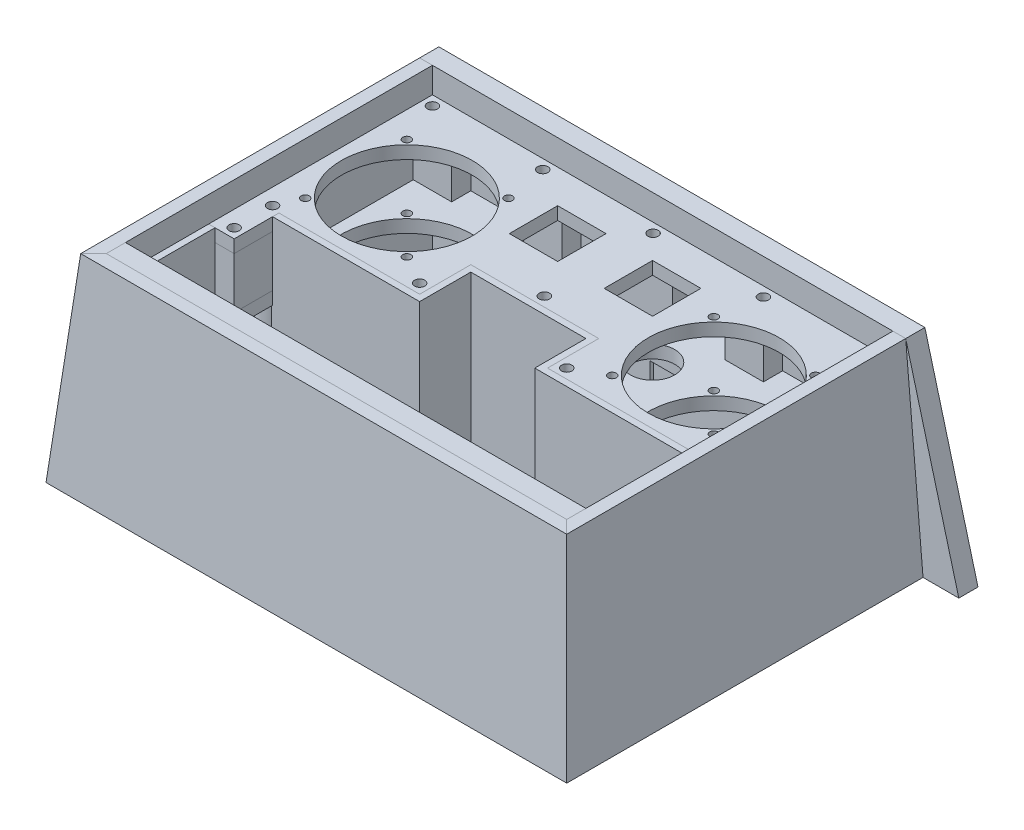
from build123d import *

# Parameters (mm, degrees)
SKETCH3_W               = 114.3
SKETCH3_H               = 88.9
SKETCH3_R               = 32.5
BOSS_EXTRUDE1_DEPTH     = 6.35
SKETCH12_W              = 12.7
SKETCH12_H              = 22.225
BOSS_EXTRUDE8_DEPTH     = 6.35
SKETCH5_R               = 10.9728
CUT_EXTRUDE1_DEPTH      = 141.992881026
SKETCH47_W              = 24
SKETCH47_H              = 24
CUT_EXTRUDE19_DEPTH     = 6.35
SKETCH22_R              = 2.0193
CUT_EXTRUDE7_DEPTH      = 143.557146436
SKETCH51_R              = 2.5527
CUT_EXTRUDE20_DEPTH     = 143.557146436
CUT_EXTRUDE5_DEPTH      = 143.557146436
CUT_EXTRUDE5_DEPTH_BACK = 143.557146436
SKETCH18_R              = 2.5527
CUT_EXTRUDE6_DEPTH      = 143.557146436
CUT_EXTRUDE6_DEPTH_BACK = 143.557146436
SKETCH19_R              = 2.5527
SKETCH19_W              = 63.5
SKETCH19_H              = 25.4
BOSS_EXTRUDE9_REACH     = 142.993
SKETCH48_W              = 19.05
SKETCH48_H              = 9.525
SKETCH48_R              = 2.5527
SKETCH48_W_2            = 28.575
BOSS_EXTRUDE11_REACH    = 142.993
SKETCH52_W              = 9.525
SKETCH52_H              = 28.575
SKETCH52_R              = 2.5527
BOSS_EXTRUDE12_DEPTH    = 3.175
SKETCH54_W              = 3.175
SKETCH54_H              = 19.05
CUT_EXTRUDE21_DEPTH     = 143.557146436
SKETCH56_W              = 60.325
SKETCH56_H              = 38.1
SKETCH56_R              = 1.5875
SKETCH56_R_2            = 9.525
BOSS_EXTRUDE14_DEPTH    = 3.175
SKETCH55_W              = 228.6
SKETCH55_H              = 76.2
BOSS_EXTRUDE13_DEPTH    = 9.525
BOSS_EXTRUDE15_DEPTH    = 9.525
CUT_EXTRUDE23_DEPTH     = 249.97517152
BOSS_EXTRUDE16_DEPTH    = 3.175
SKETCH61_W              = 111.125
SKETCH61_H              = 9.525
BOSS_EXTRUDE17_DEPTH    = 22.225
SKETCH62_R              = 4.7625
BOSS_EXTRUDE18_DEPTH    = 47.625
BOSS_EXTRUDE19_DEPTH    = 38.1
BOSS_EXTRUDE20_DEPTH    = 6.35
SKETCH65_R              = 25.4
CUT_EXTRUDE22_DEPTH     = 300.006928584
SKETCH67_R              = 4.7625
BOSS_EXTRUDE21_DEPTH    = 6.35
LPATTERN1_COUNT         = 2
LPATTERN1_PITCH         = 76.2
LPATTERN2_COUNT         = 2
LPATTERN2_PITCH         = 76.2
SKETCH68_W              = 12.7
SKETCH68_H              = 12.7
CUT_EXTRUDE24_DEPTH     = 260.504568724
BOSS_EXTRUDE23_START    = -171.45
SKETCH69_R              = 4.7625
BOSS_EXTRUDE23_DEPTH    = 177.8


with BuildPart() as part:
    # Sketch3 → Boss-Extrude1 (new body)
    with BuildSketch(Plane(origin=(0, 53.975, 0), x_dir=(1, 0, 0), z_dir=(0, 1, 0))):
        with Locations((-57.15, 31.75)):
            Rectangle(SKETCH3_W, SKETCH3_H)
        with Locations(Location((-76.2, 25.4, 0), (0, 0, 270))):
            Circle(SKETCH3_R, mode=Mode.SUBTRACT)
    extrude(amount=BOSS_EXTRUDE1_DEPTH)

    # Sketch12 → Boss-Extrude8 (add)
    with BuildSketch(Plane(origin=(0, 60.325, 0), x_dir=(1, 0, 0), z_dir=(0, 1, 0))):
        with Locations((-107.95, -23.8125)):
            Rectangle(SKETCH12_W, SKETCH12_H)
    extrude(amount=-BOSS_EXTRUDE8_DEPTH)


with BuildPart() as body_2:
    # Mirror1: mirrored copy
    add(part.part.mirror(Plane.ZX.offset(73.025)))

    # Mirror2 2: body 2 across plane


with BuildPart() as part_1:
    add(part.part)

    # Mirror2: part across plane
    add(part.part.mirror(Plane(origin=(0, 0, 0), x_dir=(0, 0, 1), z_dir=(1, 0, 0))))

    # Sketch5 → Cut-Extrude1 (cut, through all)
    with BuildSketch(Plane(origin=(0, 60.325, 0), x_dir=(1, 0, 0), z_dir=(0, 1, 0))):
        with Locations(Location((-23.548581453, 47.625, 0), (0, 0, 270))):
            Circle(SKETCH5_R)
    cut_extrude1 = extrude(amount=-CUT_EXTRUDE1_DEPTH, mode=Mode.SUBTRACT)


with BuildPart() as body_2_1:
    add(body_2.part)
    add(body_2.part.mirror(Plane(origin=(0, 0, 0), x_dir=(0, 0, 1), z_dir=(1, 0, 0))))

    # Sketch47 → Cut-Extrude19 (cut)
    with BuildSketch(Plane(origin=(0, 92.075, 0), x_dir=(1, 0, 0), z_dir=(0, 1, 0))):
        with Locations((-23.548581453, 47.625)):
            Rectangle(SKETCH47_W, SKETCH47_H)
    cut_extrude19 = extrude(amount=-CUT_EXTRUDE19_DEPTH, mode=Mode.SUBTRACT)


with BuildPart() as cut_extrude7_tool:
    # Sketch22 → Cut-Extrude7 (new, through all)
    with BuildSketch(Plane(origin=(0, 92.075, 0), x_dir=(1, 0, 0), z_dir=(0, 1, 0))):
        with Locations(Location((-101.426034419, 50.626034419, 0), (0, 0, 270))):
            Circle(SKETCH22_R)
        with Locations(Location((-50.973965581, 50.626034419, 0), (0, 0, 270))):
            Circle(SKETCH22_R)
        with Locations(Location((-50.973965581, 0.173965581, 0), (0, 0, 270))):
            Circle(SKETCH22_R)
        with Locations(Location((-101.426034419, 0.173965581, 0), (0, 0, 270))):
            Circle(SKETCH22_R)
    cut_extrude7 = extrude(amount=-CUT_EXTRUDE7_DEPTH)


with BuildPart() as part_2:
    add(part_1.part)

    # Cut-Extrude7: cut by cut_extrude7_tool
    add(cut_extrude7_tool.part, mode=Mode.SUBTRACT)


with BuildPart() as body_2_2:
    add(body_2_1.part)

    # Cut-Extrude7: cut by cut_extrude7_tool
    add(cut_extrude7_tool.part, mode=Mode.SUBTRACT)


with BuildPart() as cut_extrude20_tool:
    # Sketch51 → Cut-Extrude20 (new, through all)
    with BuildSketch(Plane(origin=(0, 92.075, 0), x_dir=(1, 0, 0), z_dir=(0, 1, 0))):
        with Locations(Location((-106.3625, -30.1625, 0), (0, 0, 270))):
            Circle(SKETCH51_R)
        with Locations(Location((-106.3625, -11.1125, 0), (0, 0, 270))):
            Circle(SKETCH51_R)
    cut_extrude20 = extrude(amount=-CUT_EXTRUDE20_DEPTH)


with BuildPart() as part_3:
    add(part_2.part)

    # Cut-Extrude20: cut by cut_extrude20_tool
    add(cut_extrude20_tool.part, mode=Mode.SUBTRACT)


with BuildPart() as body_2_3:
    add(body_2_2.part)

    # Cut-Extrude20: cut by cut_extrude20_tool
    add(cut_extrude20_tool.part, mode=Mode.SUBTRACT)


with BuildPart() as mirror8_tool:
    # Mirror8: Cut-Extrude1, Cut-Extrude19, Cut-Extrude7, Cut-Extrude20 across plane
    add(cut_extrude1.mirror(Plane(origin=(0, 0, 0), x_dir=(0, 0, 1), z_dir=(1, 0, 0))))
    add(cut_extrude19.mirror(Plane(origin=(0, 0, 0), x_dir=(0, 0, 1), z_dir=(1, 0, 0))))
    add(cut_extrude7.mirror(Plane(origin=(0, 0, 0), x_dir=(0, 0, 1), z_dir=(1, 0, 0))))
    add(cut_extrude20.mirror(Plane(origin=(0, 0, 0), x_dir=(0, 0, 1), z_dir=(1, 0, 0))))


with BuildPart() as part_4:
    add(part_3.part)

    # Mirror8: cut by mirror8_tool
    add(mirror8_tool.part, mode=Mode.SUBTRACT)


with BuildPart() as body_2_4:
    add(body_2_3.part)

    # Mirror8: cut by mirror8_tool
    add(mirror8_tool.part, mode=Mode.SUBTRACT)


with BuildPart() as cut_extrude5_tool:
    # Sketch18 → Cut-Extrude5 (new, two sides: drawn at the far end of the back side and taken through both)
    with BuildSketch(Plane(origin=(0, 92.075, 0), x_dir=(1, 0, 0), z_dir=(0, 1, 0)).offset(-CUT_EXTRUDE5_DEPTH_BACK)):
        with Locations(Location((-54.76875, 71.4375, 0), (0, 0, 90))):
            Circle(SKETCH18_R)
        with Locations(Location((-109.5375, 71.4375, 0), (0, 0, 90))):
            Circle(SKETCH18_R)
        with Locations(Location((0, 71.4375, 0), (0, 0, 90))):
            Circle(SKETCH18_R)
        with Locations(Location((109.5375, 71.4375, 0), (0, 0, 90))):
            Circle(SKETCH18_R)
        with Locations(Location((54.76875, 71.4375, 0), (0, 0, 90))):
            Circle(SKETCH18_R)
    extrude(amount=CUT_EXTRUDE5_DEPTH + CUT_EXTRUDE5_DEPTH_BACK)


with BuildPart() as part_5:
    add(part_4.part)

    # Cut-Extrude5: cut by cut_extrude5_tool
    add(cut_extrude5_tool.part, mode=Mode.SUBTRACT)


with BuildPart() as body_2_5:
    add(body_2_4.part)

    # Cut-Extrude5: cut by cut_extrude5_tool
    add(cut_extrude5_tool.part, mode=Mode.SUBTRACT)


with BuildPart() as cut_extrude6_tool:
    # Sketch19 → Cut-Extrude6 (new, two sides: drawn at the far end of the back side and taken through both)
    with BuildSketch(Plane(origin=(0, 92.075, 0), x_dir=(1, 0, 0), z_dir=(0, 1, 0)).offset(-CUT_EXTRUDE6_DEPTH_BACK)):
        with Locations(Location((-36.5125, -7.9375, 0), (0, 0, 90))):
            Circle(SKETCH19_R)
        with Locations(Location((36.5125, -7.9375, 0), (0, 0, 90))):
            Circle(SKETCH19_R)
        with Locations(Location((0, 17.4625, 0), (0, 0, 90))):
            Circle(SKETCH19_R)
        Rectangle(SKETCH19_W, SKETCH19_H)
    extrude(amount=CUT_EXTRUDE6_DEPTH + CUT_EXTRUDE6_DEPTH_BACK)


with BuildPart() as part_6:
    add(part_5.part)

    # Cut-Extrude6: cut by cut_extrude6_tool
    add(cut_extrude6_tool.part, mode=Mode.SUBTRACT)

    # Sketch54 → Cut-Extrude21 (cut, through all)
    with BuildSketch(Plane.XZ.offset(-53.975)):
        with Locations((-112.7125, 25.4)):
            Rectangle(SKETCH54_W, SKETCH54_H)
        with Locations((112.7125, 25.4)):
            Rectangle(SKETCH54_W, SKETCH54_H)
    extrude(amount=-CUT_EXTRUDE21_DEPTH, mode=Mode.SUBTRACT)


with BuildPart() as body_2_6:
    add(body_2_5.part)

    # Cut-Extrude6: cut by cut_extrude6_tool
    add(cut_extrude6_tool.part, mode=Mode.SUBTRACT)


with BuildPart() as body_3:

    # Sketch48 → Boss-Extrude9 (new, up to next)
    with BuildSketch(Plane(origin=(0, 60.325, 0), x_dir=(1, 0, 0), z_dir=(0, 1, 0)), mode=Mode.PRIVATE) as boss_extrude9_sk1:
        with Locations((-104.775, 71.4375)):
            Rectangle(SKETCH48_W, SKETCH48_H)
        with Locations(Location((-109.5375, 71.4375, 0), (0, 0, 90))):
            Circle(SKETCH48_R, mode=Mode.SUBTRACT)
    boss_extrude9_tool1 = extrude(boss_extrude9_sk1.sketch, amount=BOSS_EXTRUDE9_REACH, mode=Mode.PRIVATE) - body_2_6.part
    # Sketch48 → Boss-Extrude9 (new, up to next)
    with BuildSketch(Plane(origin=(0, 60.325, 0), x_dir=(1, 0, 0), z_dir=(0, 1, 0)), mode=Mode.PRIVATE) as boss_extrude9_sk2:
        with Locations((-50.00625, 71.4375)):
            Rectangle(SKETCH48_W, SKETCH48_H)
        with Locations(Location((-54.76875, 71.4375, 0), (0, 0, 90))):
            Circle(SKETCH48_R, mode=Mode.SUBTRACT)
    boss_extrude9_tool2 = extrude(boss_extrude9_sk2.sketch, amount=BOSS_EXTRUDE9_REACH, mode=Mode.PRIVATE) - body_2_6.part
    # Sketch48 → Boss-Extrude9 (new, up to next)
    with BuildSketch(Plane(origin=(0, 60.325, 0), x_dir=(1, 0, 0), z_dir=(0, 1, 0)), mode=Mode.PRIVATE) as boss_extrude9_sk3:
        with Locations((0, 71.4375)):
            Rectangle(SKETCH48_W_2, SKETCH48_H)
        with Locations(Location((0, 71.4375, 0), (0, 0, 90))):
            Circle(SKETCH48_R, mode=Mode.SUBTRACT)
    boss_extrude9_tool3 = extrude(boss_extrude9_sk3.sketch, amount=BOSS_EXTRUDE9_REACH, mode=Mode.PRIVATE) - body_2_6.part
    # Sketch48 → Boss-Extrude9 (new, up to next)
    with BuildSketch(Plane(origin=(0, 60.325, 0), x_dir=(1, 0, 0), z_dir=(0, 1, 0)), mode=Mode.PRIVATE) as boss_extrude9_sk4:
        with Locations((50.00625, 71.4375)):
            Rectangle(SKETCH48_W, SKETCH48_H)
        with Locations(Location((54.76875, 71.4375, 0), (0, 0, 90))):
            Circle(SKETCH48_R, mode=Mode.SUBTRACT)
    boss_extrude9_tool4 = extrude(boss_extrude9_sk4.sketch, amount=BOSS_EXTRUDE9_REACH, mode=Mode.PRIVATE) - body_2_6.part
    # Sketch48 → Boss-Extrude9 (new, up to next)
    with BuildSketch(Plane(origin=(0, 60.325, 0), x_dir=(1, 0, 0), z_dir=(0, 1, 0)), mode=Mode.PRIVATE) as boss_extrude9_sk5:
        with Locations((104.775, 71.4375)):
            Rectangle(SKETCH48_W, SKETCH48_H)
        with Locations(Location((109.5375, 71.4375, 0), (0, 0, 90))):
            Circle(SKETCH48_R, mode=Mode.SUBTRACT)
    boss_extrude9_tool5 = extrude(boss_extrude9_sk5.sketch, amount=BOSS_EXTRUDE9_REACH, mode=Mode.PRIVATE) - body_2_6.part
    add(boss_extrude9_tool1.solids().sort_by_distance((-104.169362, 60.325, -71.4375))[0])
    add(boss_extrude9_tool2.solids().sort_by_distance((-49.400612, 60.325, -71.4375))[0])
    add(boss_extrude9_tool3.solids().sort_by_distance((0, 60.325, -75.898793))[0])
    add(boss_extrude9_tool4.solids().sort_by_distance((49.400612, 60.325, -71.4375))[0])
    add(boss_extrude9_tool5.solids().sort_by_distance((104.169362, 60.325, -71.4375))[0])


with BuildPart() as body_4:

    # Sketch52 → Boss-Extrude11 (new, up to next)
    with BuildSketch(Plane(origin=(0, 60.325, 0), x_dir=(1, 0, 0), z_dir=(0, 1, 0)), mode=Mode.PRIVATE) as boss_extrude11_sk1:
        with Locations((-106.3625, -20.6375)):
            Rectangle(SKETCH52_W, SKETCH52_H)
        with Locations(Location((-106.3625, -30.1625, 0), (0, 0, 90))):
            Circle(SKETCH52_R, mode=Mode.SUBTRACT)
        with Locations(Location((-106.3625, -11.1125, 0), (0, 0, 90))):
            Circle(SKETCH52_R, mode=Mode.SUBTRACT)
    boss_extrude11_tool1 = extrude(boss_extrude11_sk1.sketch, amount=BOSS_EXTRUDE11_REACH, mode=Mode.PRIVATE) - body_2_6.part
    add(boss_extrude11_tool1.solids().sort_by_distance((-106.3625, 60.325, 20.6375))[0])


with BuildPart() as body_5:
    # Sketch53 → Boss-Extrude12 (new body)
    with BuildSketch(Plane.ZY.offset(111.125)):
        Polygon((34.925, 92.075), (34.925, 85.725), (6.35, 85.725), (6.35, 60.325), (15.875, 60.325), (15.875, 53.975), (15.875, 47.625), (76.2, 47.625), (76.2, 92.075), align=None)
    extrude(amount=BOSS_EXTRUDE12_DEPTH)

    # Sketch56 → Boss-Extrude14 (add)
    with BuildSketch(Plane.ZY.offset(114.3)):
        with Locations((46.0375, 28.575)):
            Rectangle(SKETCH56_W, SKETCH56_H)
        with Locations((26.035, 43.815)):
            Circle(SKETCH56_R, mode=Mode.SUBTRACT)
        with Locations((56.515, 43.815)):
            Circle(SKETCH56_R, mode=Mode.SUBTRACT)
        with Locations((56.515, 13.335)):
            Circle(SKETCH56_R, mode=Mode.SUBTRACT)
        with Locations((26.035, 13.335)):
            Circle(SKETCH56_R, mode=Mode.SUBTRACT)
        with Locations((41.275, 28.575)):
            Circle(SKETCH56_R_2, mode=Mode.SUBTRACT)
    extrude(amount=-BOSS_EXTRUDE14_DEPTH)


with BuildPart() as body_6:
    # Mirror9: mirrored copy
    add(body_5.part.mirror(Plane(origin=(0, 0, 0), x_dir=(0, 0, 1), z_dir=(1, 0, 0))))


with BuildPart() as body_7:
    # Mirror9 2: mirrored copy
    add(body_4.part.mirror(Plane(origin=(0, 0, 0), x_dir=(0, 0, 1), z_dir=(1, 0, 0))))


with BuildPart() as body_8:
    # Sketch55 → Boss-Extrude13 (new body)
    with BuildSketch(Plane.XY.offset(76.2)):
        with Locations((0, 66.675)):
            Rectangle(SKETCH55_W, SKETCH55_H)
    extrude(amount=BOSS_EXTRUDE13_DEPTH)

    # Sketch66 → Cut-Extrude23 (cut, through all)
    with BuildSketch(Plane.XY.offset(85.725)):
        Polygon((5.499261314, 57.15), (10.998522628, 66.675), (5.499261314, 76.2), (-5.499261314, 76.2), (-10.998522628, 66.675), (-5.499261314, 57.15), align=None)
        Polygon((19.247414599, 61.9125), (13.748153285, 52.3875), (19.247414599, 42.8625), (30.245937227, 42.8625), (35.745198541, 52.3875), (30.245937227, 61.9125), align=None)
        Polygon((30.245937227, 71.4375), (35.745198541, 80.9625), (30.245937227, 90.4875), (19.247414599, 90.4875), (13.748153285, 80.9625), (19.247414599, 71.4375), align=None)
        Polygon((68.740766425, 61.9125), (63.241505111, 52.3875), (68.740766425, 42.8625), (79.739289053, 42.8625), (85.238550367, 52.3875), (79.739289053, 61.9125), align=None)
        Polygon((79.739289053, 71.4375), (85.238550367, 80.9625), (79.739289053, 90.4875), (68.740766425, 90.4875), (63.241505111, 80.9625), (68.740766425, 71.4375), align=None)
        Polygon((54.99261314, 57.15), (60.491874454, 66.675), (54.99261314, 76.2), (43.994090512, 76.2), (38.494829198, 66.675), (43.994090512, 57.15), align=None)
        Polygon((-79.739289053, 61.9125), (-68.740766425, 61.9125), (-63.241505111, 52.3875), (-68.740766425, 42.8625), (-79.739289053, 42.8625), (-85.238550367, 52.3875), align=None)
        Polygon((-68.740766425, 71.4375), (-79.739289053, 71.4375), (-85.238550367, 80.9625), (-79.739289053, 90.4875), (-68.740766425, 90.4875), (-63.241505111, 80.9625), align=None)
        Polygon((-43.994090512, 57.15), (-54.99261314, 57.15), (-60.491874454, 66.675), (-54.99261314, 76.2), (-43.994090512, 76.2), (-38.494829198, 66.675), align=None)
        Polygon((-19.247414599, 71.4375), (-30.245937227, 71.4375), (-35.745198541, 80.9625), (-30.245937227, 90.4875), (-19.247414599, 90.4875), (-13.748153285, 80.9625), align=None)
        Polygon((-30.245937227, 61.9125), (-19.247414599, 61.9125), (-13.748153285, 52.3875), (-19.247414599, 42.8625), (-30.245937227, 42.8625), (-35.745198541, 52.3875), align=None)
    extrude(amount=-CUT_EXTRUDE23_DEPTH, mode=Mode.SUBTRACT)


with BuildPart() as body_9:
    # Sketch57 → Boss-Extrude15 (new body)
    with BuildSketch(Plane(origin=(0, 0, -76.2), x_dir=(-1, 0, 0), z_dir=(0, 0, -1))):
        Polygon((-120.65, 104.775), (120.65, 104.775), (147.022899265, 6.35), (-147.022899265, 6.35), align=None)
    extrude(amount=BOSS_EXTRUDE15_DEPTH)

    # Sketch68 → Cut-Extrude24 (cut, through all)
    with BuildSketch(Plane.XY.offset(-85.725)):
        with Locations((76.2, 25.4)):
            Rectangle(SKETCH68_W, SKETCH68_H)
        with Locations((0, 25.4)):
            Rectangle(SKETCH68_W, SKETCH68_H)
        with Locations((-76.2, 25.4)):
            Rectangle(SKETCH68_W, SKETCH68_H)
    extrude(amount=CUT_EXTRUDE24_DEPTH, mode=Mode.SUBTRACT)


with BuildPart() as body_10:
    # Sweep1: sweep along a path in Sketch59
    with BuildLine(Plane(origin=(0, 104.775, 0), x_dir=(1, 0, 0), z_dir=(0, 1, 0))) as sweep1_path:
        Line((-114.3, 76.2), (-114.3, -85.725))
        Line((-114.3, -85.725), (114.3, -85.725))
        Line((114.3, -85.725), (114.3, 76.2))
    # Sketch58 → Sweep1 (sweep)
    with BuildSketch(Plane.XY.offset(-76.2)):
        Polygon((-129.261071708, 6.35), (-120.65, 104.775), (-114.3, 104.775), (-114.3, 6.35), align=None)
    sweep(path=sweep1_path.line, transition=Transition.RIGHT)


with BuildPart() as body_11:
    # Sketch60 → Boss-Extrude16 (new body)
    with BuildSketch(Plane(origin=(-114.3, 0, 0), x_dir=(0, 0, -1), z_dir=(1, 0, 0))):
        Polygon((-85.725, 28.575), (-76.2, 28.575), (-76.2, 9.525), (-15.875, 9.525), (-15.875, 53.975), (-9.525, 53.975), (-9.525, 6.35), (-85.725, 6.35), align=None)
    extrude(amount=BOSS_EXTRUDE16_DEPTH)


with BuildPart() as body_12:
    # Sketch61 → Boss-Extrude17 (new body)
    with BuildSketch(Plane.XZ.offset(-28.575)):
        with Locations((-55.5625, 80.9625)):
            Rectangle(SKETCH61_W, SKETCH61_H)
    extrude(amount=BOSS_EXTRUDE17_DEPTH)


with BuildPart() as body_13:
    # Sketch62 → Boss-Extrude18 (new body)
    with BuildSketch(Plane.XZ.offset(-53.975)):
        with BuildLine():
            Line((-106.3625, 4.7625), (-114.3, 4.7625))
            Line((-114.3, 4.7625), (-114.3, 15.875))
            Line((-114.3, 15.875), (-110.562630206, 15.875))
            ThreePointArc((-110.562630206, 15.875), (-106.3625, 17.4625), (-102.162369794, 15.875))
            Line((-102.162369794, 15.875), (-28.575, 15.875))
            Line((-28.575, 15.875), (-28.575, -9.525))
            Line((-28.575, -9.525), (0, -9.525))
            Line((0, -9.525), (0, -12.7))
            Line((0, -12.7), (-31.75, -12.7))
            Line((-31.75, -12.7), (-31.75, 12.7))
            Line((-31.75, 12.7), (-100.214138938, 12.7))
            ThreePointArc((-100.214138938, 12.7), (-101.342384214, 7.223935033), (-106.3625, 4.7625))
        make_face()
        with Locations(Location((-106.3625, 11.1125, 0), (0, 0, 90))):
            Circle(SKETCH62_R, mode=Mode.SUBTRACT)
    extrude(amount=BOSS_EXTRUDE18_DEPTH)


with BuildPart() as body_14:
    # Sketch63 → Boss-Extrude19 (new body)
    with BuildSketch(Plane(origin=(0, 53.975, 0), x_dir=(1, 0, 0), z_dir=(0, 1, 0))):
        Polygon((-101.6, -12.7), (-101.6, -15.875), (-28.575, -15.875), (-28.575, 9.525), (0, 9.525), (0, 12.7), (-31.75, 12.7), (-31.75, -12.7), align=None)
    extrude(amount=BOSS_EXTRUDE19_DEPTH)


with BuildPart() as body_15:
    # Mirror14: mirrored copy
    add(body_14.part.mirror(Plane(origin=(0, 0, 0), x_dir=(0, 0, 1), z_dir=(1, 0, 0))))


with BuildPart() as body_16:
    # Mirror14 2: mirrored copy
    add(body_13.part.mirror(Plane(origin=(0, 0, 0), x_dir=(0, 0, 1), z_dir=(1, 0, 0))))


with BuildPart() as body_17:
    # Mirror14 3: mirrored copy
    add(body_12.part.mirror(Plane(origin=(0, 0, 0), x_dir=(0, 0, 1), z_dir=(1, 0, 0))))


with BuildPart() as body_18:
    # Mirror14 4: mirrored copy
    add(body_11.part.mirror(Plane(origin=(0, 0, 0), x_dir=(0, 0, 1), z_dir=(1, 0, 0))))


with BuildPart() as body_10_1:
    add(body_10.part)

    # Combine1: union body 17, body 12, body 16, body 13, body 18, body 11, body 14, body 15
    add(body_17.part)
    add(body_12.part)
    add(body_16.part)
    add(body_13.part)
    add(body_18.part)
    add(body_11.part)
    add(body_14.part)
    add(body_15.part)

    # Sketch64 → Boss-Extrude20 (add)
    with BuildSketch(Plane.XZ.offset(-6.35)):
        with BuildLine():
            Line((111.125, 76.2), (-111.125, 76.2))
            Line((-111.125, 76.2), (-111.125, 15.875))
            Line((-111.125, 15.875), (-110.562630206, 15.875))
            ThreePointArc((-110.562630206, 15.875), (-106.3625, 17.4625), (-102.162369794, 15.875))
            Line((-102.162369794, 15.875), (-28.575, 15.875))
            Line((-28.575, 15.875), (-28.575, -9.525))
            Line((-28.575, -9.525), (28.575, -9.525))
            Line((28.575, -9.525), (28.575, 15.875))
            Line((28.575, 15.875), (102.162369794, 15.875))
            ThreePointArc((102.162369794, 15.875), (106.3625, 17.4625), (110.562630206, 15.875))
            Line((110.562630206, 15.875), (111.125, 15.875))
            Line((111.125, 15.875), (111.125, 76.2))
        make_face()
    extrude(amount=-BOSS_EXTRUDE20_DEPTH)

    # Sketch65 → Cut-Extrude22 (cut, through all)
    with BuildSketch(Plane(origin=(-114.3, 0, 0), x_dir=(0, 0, -1), z_dir=(1, 0, 0))):
        with Locations((-41.275, 28.575)):
            Circle(SKETCH65_R)
    extrude(amount=-CUT_EXTRUDE22_DEPTH, mode=Mode.SUBTRACT)


with BuildPart() as body_11_2:
    # Sketch67 → Boss-Extrude21 (new, symmetric)
    with BuildSketch(Plane(origin=(0, 0, 0), x_dir=(0, 0, -1), z_dir=(1, 0, 0))):
        with BuildLine():
            Line((85.725, 6.35), (85.725, 19.05))
            Line((85.725, 19.05), (78.105, 19.05))
            Line((78.105, 19.05), (78.105, 31.75))
            Line((78.105, 31.75), (85.725, 31.75))
            Line((85.725, 31.75), (85.725, 44.45))
            Line((85.725, 44.45), (92.075, 44.45))
            Line((92.075, 44.45), (112.395, 29.21))
            ThreePointArc((112.395, 29.21), (116.823277885, 15.033907372), (104.775, 6.35))
            Line((104.775, 6.35), (85.725, 6.35))
        make_face()
        with Locations((104.775, 19.05)):
            Circle(SKETCH67_R, mode=Mode.SUBTRACT)
    extrude(amount=BOSS_EXTRUDE21_DEPTH, both=True)


with BuildPart() as lpattern1_1:
    # LPattern1: pattern copy
    add(body_11_2.part.moved(Location(Vector(-1, 0, 0) * (1 * LPATTERN1_PITCH))))


with BuildPart() as lpattern2_1:
    # LPattern2: pattern copy
    add(body_11_2.part.moved(Location(Vector(1, 0, 0) * (1 * LPATTERN2_PITCH))))


with BuildPart() as body_14_2:
    # Sketch69 → Boss-Extrude23 (new body)
    with BuildSketch(Plane.ZY.offset(82.55).offset(BOSS_EXTRUDE23_START)):
        with Locations((-104.775, 19.05)):
            Circle(SKETCH69_R)
    extrude(amount=BOSS_EXTRUDE23_DEPTH)


solid = Compound([part_6.part, body_2_6.part, body_3.part, body_4.part, body_5.part, body_6.part, body_7.part, body_8.part, body_9.part, body_10_1.part, body_11_2.part, lpattern1_1.part, lpattern2_1.part, body_14_2.part])
